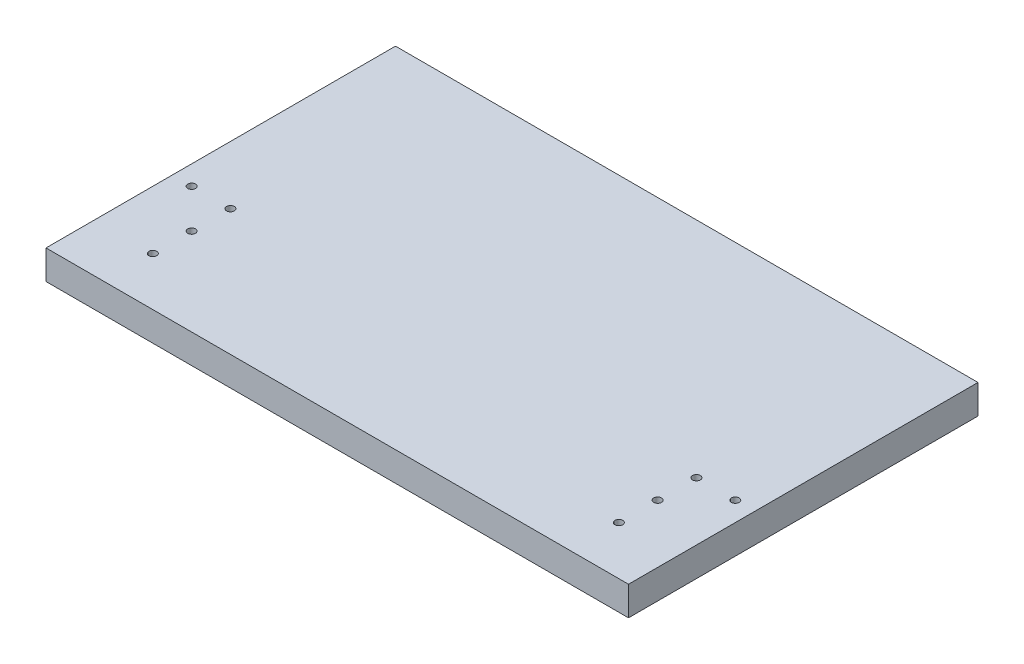
from build123d import *

# Parameters (mm, degrees)
CROQUIS1_W              = 300
CROQUIS1_H              = 180
SALIENTE_EXTRUIR1_DEPTH = 15
CROQUIS2_R              = 2
CORTAR_EXTRUIR1_DEPTH   = 10


with BuildPart() as part:
    # Croquis1 → Saliente-Extruir1 (new body)
    with BuildSketch(Plane(origin=(0, 0, 0), x_dir=(1, 0, 0), z_dir=(0, 1, 0))):
        Rectangle(CROQUIS1_W, CROQUIS1_H)
    extrude(amount=SALIENTE_EXTRUIR1_DEPTH)

    # Croquis2 → Cortar-Extruir1 (cut)
    with BuildSketch(Plane(origin=(0, 15, 0), x_dir=(1, 0, 0), z_dir=(0, 1, 0))):
        with Locations((-120, -65)):
            Circle(CROQUIS2_R)
        with Locations((-120, -45)):
            Circle(CROQUIS2_R)
        with Locations((120, -65)):
            Circle(CROQUIS2_R)
        with Locations((120, -45)):
            Circle(CROQUIS2_R)
        with Locations((-140, -25)):
            Circle(CROQUIS2_R)
        with Locations((-120, -25)):
            Circle(CROQUIS2_R)
        with Locations((120, -25)):
            Circle(CROQUIS2_R)
        with Locations((140, -25)):
            Circle(CROQUIS2_R)
    extrude(amount=-CORTAR_EXTRUIR1_DEPTH, mode=Mode.SUBTRACT)


solid = part.part
